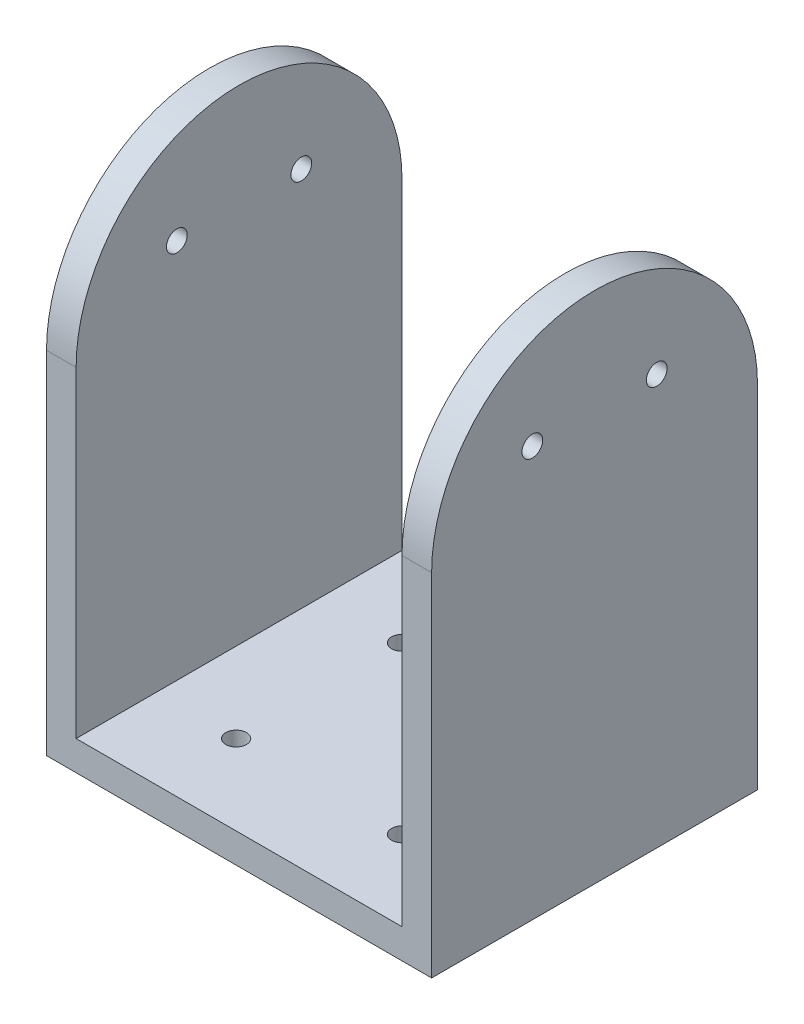
from build123d import *

# Parameters (mm, degrees)
SKETCH1_W           = 65
SKETCH1_H           = 55
BOSS_EXTRUDE1_DEPTH = 5
SKETCH2_W           = 5
SKETCH2_H           = 55
BOSS_EXTRUDE2_DEPTH = 81.75
CUT_EXTRUDE1_REACH  = 113.834
SKETCH3_R           = 1.75
CUT_EXTRUDE2_REACH  = 98.634
SKETCH4_R           = 1.75


with BuildPart() as part:
    # Sketch1 → Boss-Extrude1 (new body)
    with BuildSketch(Plane(origin=(0, 0, 0), x_dir=(1, 0, 0), z_dir=(0, 1, 0))):
        Rectangle(SKETCH1_W, SKETCH1_H)
    extrude(amount=BOSS_EXTRUDE1_DEPTH)

    # Sketch2 → Boss-Extrude2 (add)
    with BuildSketch(Plane(origin=(0, 5, 0), x_dir=(1, 0, 0), z_dir=(0, 1, 0))):
        with Locations((-30, 0)):
            Rectangle(SKETCH2_W, SKETCH2_H)
        with Locations((30, 0)):
            Rectangle(SKETCH2_W, SKETCH2_H)
    extrude(amount=BOSS_EXTRUDE2_DEPTH)

    # Sketch3 → Cut-Extrude1 (cut, up to next)
    with BuildSketch(Plane.ZY.offset(32.5), mode=Mode.PRIVATE) as cut_extrude1_sk1:
        with BuildLine():
            Line((27.5, 86.75), (-2.9e-08, 86.75))
            ThreePointArc((-2.9e-08, 86.75), (19.445436472, 78.695436493), (27.5, 59.25))
            Line((27.5, 59.25), (27.5, 86.75))
        make_face()
    cut_extrude1_tool1 = extrude(cut_extrude1_sk1.sketch, amount=-CUT_EXTRUDE1_REACH, mode=Mode.PRIVATE) & part.part
    # Sketch3 → Cut-Extrude1 (cut, up to next)
    with BuildSketch(Plane.ZY.offset(32.5), mode=Mode.PRIVATE) as cut_extrude1_sk2:
        with BuildLine():
            Line((-2.9e-08, 86.75), (-27.5, 86.75))
            Line((-27.5, 86.75), (-27.5, 59.25))
            ThreePointArc((-27.5, 59.25), (-19.445436493, 78.695436472), (-2.9e-08, 86.75))
        make_face()
    cut_extrude1_tool2 = extrude(cut_extrude1_sk2.sketch, amount=-CUT_EXTRUDE1_REACH, mode=Mode.PRIVATE) & part.part
    # Sketch3 → Cut-Extrude1 (cut, up to next)
    with BuildSketch(Plane.ZY.offset(32.5), mode=Mode.PRIVATE) as cut_extrude1_sk3:
        with Locations((-10.5, 69.25)):
            Circle(SKETCH3_R)
    cut_extrude1_tool3 = extrude(cut_extrude1_sk3.sketch, amount=-CUT_EXTRUDE1_REACH, mode=Mode.PRIVATE) & part.part
    # Sketch3 → Cut-Extrude1 (cut, up to next)
    with BuildSketch(Plane.ZY.offset(32.5), mode=Mode.PRIVATE) as cut_extrude1_sk4:
        with Locations((10.5, 69.25)):
            Circle(SKETCH3_R)
    cut_extrude1_tool4 = extrude(cut_extrude1_sk4.sketch, amount=-CUT_EXTRUDE1_REACH, mode=Mode.PRIVATE) & part.part
    cut_extrude1_1 = cut_extrude1_tool1.solids().sort_by_distance((-32.5, 80.607382, 21.357382))[0]
    add(cut_extrude1_1, mode=Mode.SUBTRACT)
    cut_extrude1_2 = cut_extrude1_tool2.solids().sort_by_distance((-32.5, 80.607382, -21.357382))[0]
    add(cut_extrude1_2, mode=Mode.SUBTRACT)
    cut_extrude1_3 = cut_extrude1_tool3.solids().sort_by_distance((-32.5, 69.25, -10.5))[0]
    add(cut_extrude1_3, mode=Mode.SUBTRACT)
    cut_extrude1_4 = cut_extrude1_tool4.solids().sort_by_distance((-32.5, 69.25, 10.5))[0]
    add(cut_extrude1_4, mode=Mode.SUBTRACT)
    cut_extrude1 = cut_extrude1_1 + cut_extrude1_2 + cut_extrude1_3 + cut_extrude1_4  # Cut-Extrude1 as one shape, for the pattern or mirror that repeats it

    # Mirror1: Cut-Extrude1 across plane
    add(cut_extrude1.mirror(Plane(origin=(0, 0, 0), x_dir=(0, 0, 1), z_dir=(1, 0, 0))), mode=Mode.SUBTRACT)

    # Sketch4 → Cut-Extrude2 (cut, up to next)
    with BuildSketch(Plane.XZ, mode=Mode.PRIVATE) as cut_extrude2_sk1:
        with Locations((-14, 14)):
            Circle(SKETCH4_R)
    cut_extrude2_tool1 = extrude(cut_extrude2_sk1.sketch, amount=-CUT_EXTRUDE2_REACH, mode=Mode.PRIVATE) & part.part
    # Sketch4 → Cut-Extrude2 (cut, up to next)
    with BuildSketch(Plane.XZ, mode=Mode.PRIVATE) as cut_extrude2_sk2:
        with Locations((-14, -14)):
            Circle(SKETCH4_R)
    cut_extrude2_tool2 = extrude(cut_extrude2_sk2.sketch, amount=-CUT_EXTRUDE2_REACH, mode=Mode.PRIVATE) & part.part
    # Sketch4 → Cut-Extrude2 (cut, up to next)
    with BuildSketch(Plane.XZ, mode=Mode.PRIVATE) as cut_extrude2_sk3:
        with Locations((14, -14)):
            Circle(SKETCH4_R)
    cut_extrude2_tool3 = extrude(cut_extrude2_sk3.sketch, amount=-CUT_EXTRUDE2_REACH, mode=Mode.PRIVATE) & part.part
    # Sketch4 → Cut-Extrude2 (cut, up to next)
    with BuildSketch(Plane.XZ, mode=Mode.PRIVATE) as cut_extrude2_sk4:
        with Locations((14, 14)):
            Circle(SKETCH4_R)
    cut_extrude2_tool4 = extrude(cut_extrude2_sk4.sketch, amount=-CUT_EXTRUDE2_REACH, mode=Mode.PRIVATE) & part.part
    add(cut_extrude2_tool1.solids().sort_by_distance((-14, 0, 14))[0], mode=Mode.SUBTRACT)
    add(cut_extrude2_tool2.solids().sort_by_distance((-14, 0, -14))[0], mode=Mode.SUBTRACT)
    add(cut_extrude2_tool3.solids().sort_by_distance((14, 0, -14))[0], mode=Mode.SUBTRACT)
    add(cut_extrude2_tool4.solids().sort_by_distance((14, 0, 14))[0], mode=Mode.SUBTRACT)


solid = part.part
